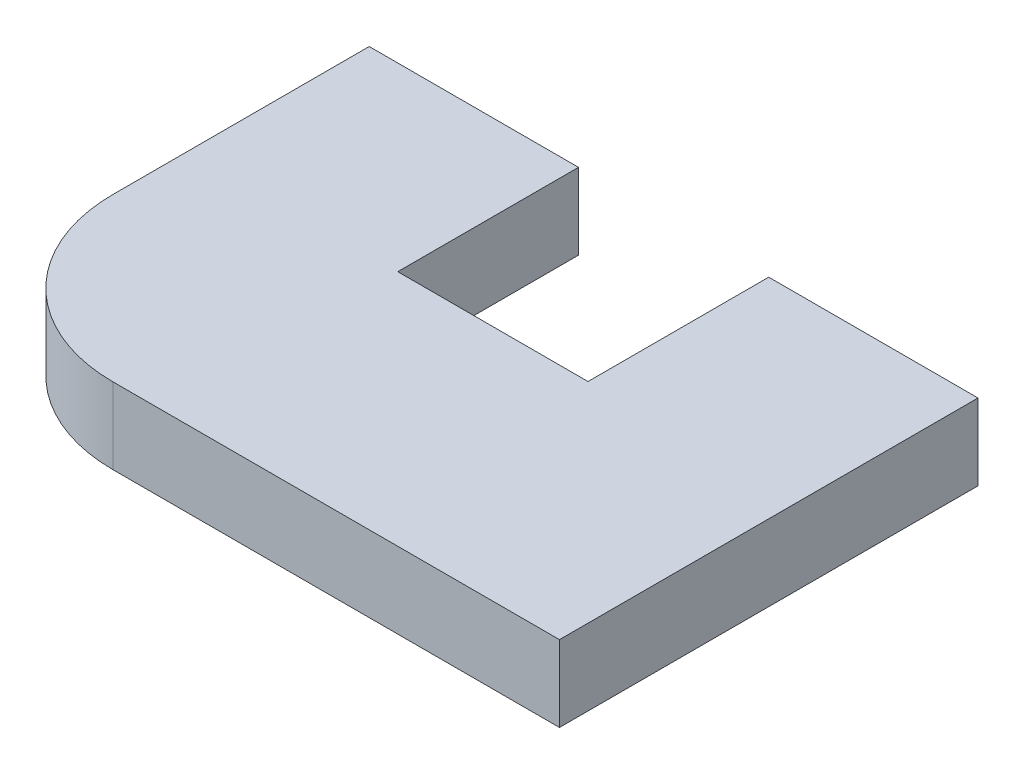
from build123d import *

# Parameters (mm, degrees)
BOSS_EXTRUDE1_DEPTH = 40


with BuildPart() as part:
    # Sketch1 → Boss-Extrude1 (new body)
    with BuildSketch(Plane(origin=(0, 0, 0), x_dir=(1, 0, 0), z_dir=(0, 1, 0))):
        with BuildLine():
            ThreePointArc((-55, -24.644660941), (-30, -85), (30.355339059, -110))
            Line((30.355339059, -110), (265, -110))
            Line((265, -110), (265, 110))
            Line((265, 110), (155, 110))
            Line((155, 110), (155, 15))
            Line((155, 15), (55, 15))
            Line((55, 15), (55, 110))
            Line((55, 110), (-55, 110))
            Line((-55, 110), (-55, -24.644660941))
        make_face()
    extrude(amount=BOSS_EXTRUDE1_DEPTH)


solid = part.part
